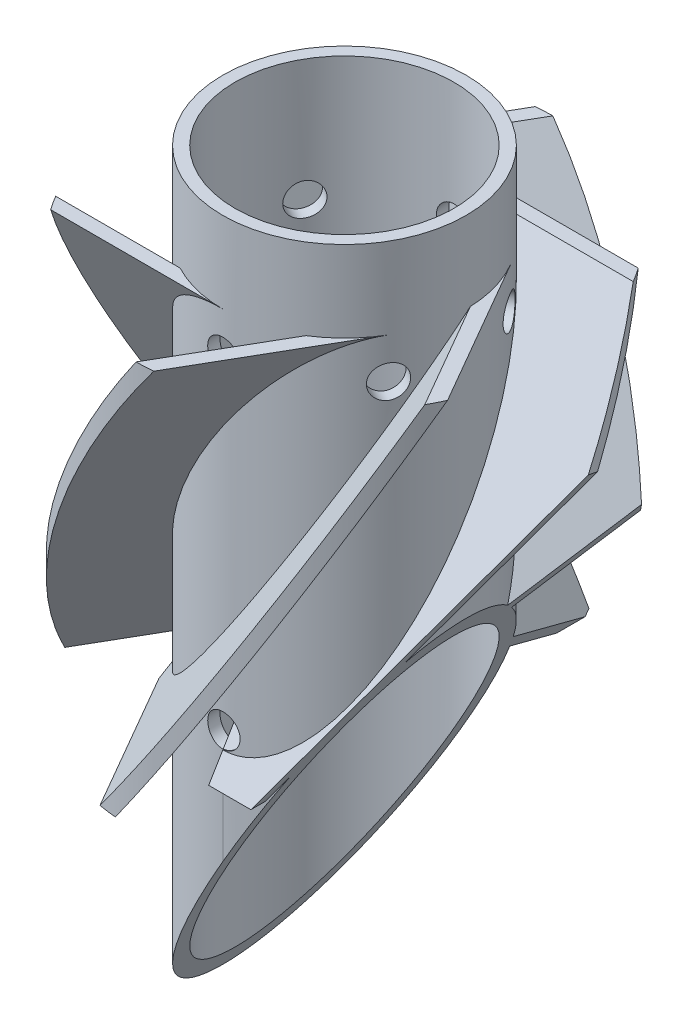
from build123d import *

# Parameters (mm, degrees)
SKETCH_1_R               = 30
SKETCH_1_R_2             = 27
EXTRUDE_1_DEPTH          = 190
SKETCH_7_R               = 4
CUT_EXTRUDE_2_DEPTH      = 195.679223339
PATTERN_CIRCULAR_2_COUNT = 6
SKETCH_6_W               = 122.433192936
SKETCH_6_H               = 60
EXTRUDE_2_DEPTH          = 3
PATTERN_CIRCULAR_3_COUNT = 6
CUT_EXTRUDE_START        = -20
SKETCH_9_R               = 77.362632739
SKETCH_9_R_2             = 30
CUT_EXTRUDE_3_DEPTH      = 20
SKETCH_10_R              = 90.868714324
SKETCH_10_R_2            = 52
CUT_EXTRUDE_4_DEPTH      = 190
SKETCH_11_R              = 68.502680694
SKETCH_11_R_2            = 30
CUT_EXTRUDE_5_DEPTH      = 70
CUT_EXTRUDE_6_DEPTH      = 204.735122249
CUT_EXTRUDE_6_DEPTH_BACK = 204.735122249
SKETCH_13_R              = 27
CUT_EXTRUDE_7_DEPTH      = 204.735122249


with BuildPart() as part:
    # 草图1 → 凸台-拉伸1 (new body)
    with BuildSketch(Plane(origin=(0, 0, 0), x_dir=(1, 0, 0), z_dir=(0, 1, 0))):
        Circle(SKETCH_1_R)
        Circle(SKETCH_1_R_2, mode=Mode.SUBTRACT)
    extrude(amount=EXTRUDE_1_DEPTH)

    # 草图7 → 切除-拉伸2 (cut, through all)
    with BuildSketch(Plane.XY):
        with Locations((0, 80)):
            Circle(SKETCH_7_R)
        with Locations((0.008254313, 160)):
            Circle(SKETCH_7_R)
    cut_extrude_2 = extrude(amount=-CUT_EXTRUDE_2_DEPTH, mode=Mode.SUBTRACT)

    # 阵列(圆周)2: 切除-拉伸2 ×6 about axis
    pattern_circular_2_axis = Axis((0, 190, 0), (0, -1, 0))
    for i in range(1, PATTERN_CIRCULAR_2_COUNT):
        add(cut_extrude_2.rotate(pattern_circular_2_axis, i * 360 / PATTERN_CIRCULAR_2_COUNT), mode=Mode.SUBTRACT)

    # 草图6 → 凸台-拉伸2 (add)
    with BuildSketch(Plane(origin=(0, 31.764705882, 52.941176471), x_dir=(0, -0.8574929257125442, 0.5144957554275265), z_dir=(0, 0.5144957554275265, 0.8574929257125442))):
        with Locations((-99.992073566, 30)):
            Rectangle(SKETCH_6_W, SKETCH_6_H)
    extrude_2 = extrude(amount=EXTRUDE_2_DEPTH)

    # 阵列(圆周)3: 凸台-拉伸2 ×6 about axis
    pattern_circular_3_axis = Axis((0, 190, 0), (0, -1, 0))
    for i in range(1, PATTERN_CIRCULAR_3_COUNT):
        add(extrude_2.rotate(pattern_circular_3_axis, i * 360 / PATTERN_CIRCULAR_3_COUNT))

    # 草图9 → 切除-拉伸3 (cut)
    with BuildSketch(Plane(origin=(0, 190, 0), x_dir=(1, 0, 0), z_dir=(0, 1, 0)).offset(CUT_EXTRUDE_START)):
        Circle(SKETCH_9_R)
        Circle(SKETCH_9_R_2, mode=Mode.SUBTRACT)
    extrude(amount=CUT_EXTRUDE_3_DEPTH, mode=Mode.SUBTRACT)

    # 草图10 → 切除-拉伸4 (cut)
    with BuildSketch(Plane(origin=(0, 190, 0), x_dir=(1, 0, 0), z_dir=(0, 1, 0))):
        Circle(SKETCH_10_R)
        Circle(SKETCH_10_R_2, mode=Mode.SUBTRACT)
    extrude(amount=-CUT_EXTRUDE_4_DEPTH, mode=Mode.SUBTRACT)

    # 草图11 → 切除-拉伸5 (cut)
    with BuildSketch(Plane(origin=(0, 0, 0), x_dir=(1, 0, 0), z_dir=(0, 1, 0))):
        Circle(SKETCH_11_R)
        Circle(SKETCH_11_R_2, mode=Mode.SUBTRACT)
    extrude(amount=CUT_EXTRUDE_5_DEPTH, mode=Mode.SUBTRACT)

    # 草图12 → 切除-拉伸6 (cut, two sides: drawn at the far end of the back side and taken through both)
    with BuildSketch(Plane.XY.offset(-CUT_EXTRUDE_6_DEPTH_BACK)):
        Polygon((-30, 0), (75.089826427, 182.02091873), (75.089826427, 0), align=None)
    extrude(amount=CUT_EXTRUDE_6_DEPTH + CUT_EXTRUDE_6_DEPTH_BACK, mode=Mode.SUBTRACT)

    # 草图13 → 切除-拉伸7 (cut, through all)
    with BuildSketch(Plane(origin=(0, 0, 0), x_dir=(1, 0, 0), z_dir=(0, 1, 0))):
        Circle(SKETCH_13_R)
    extrude(amount=CUT_EXTRUDE_7_DEPTH, mode=Mode.SUBTRACT)


solid = part.part
